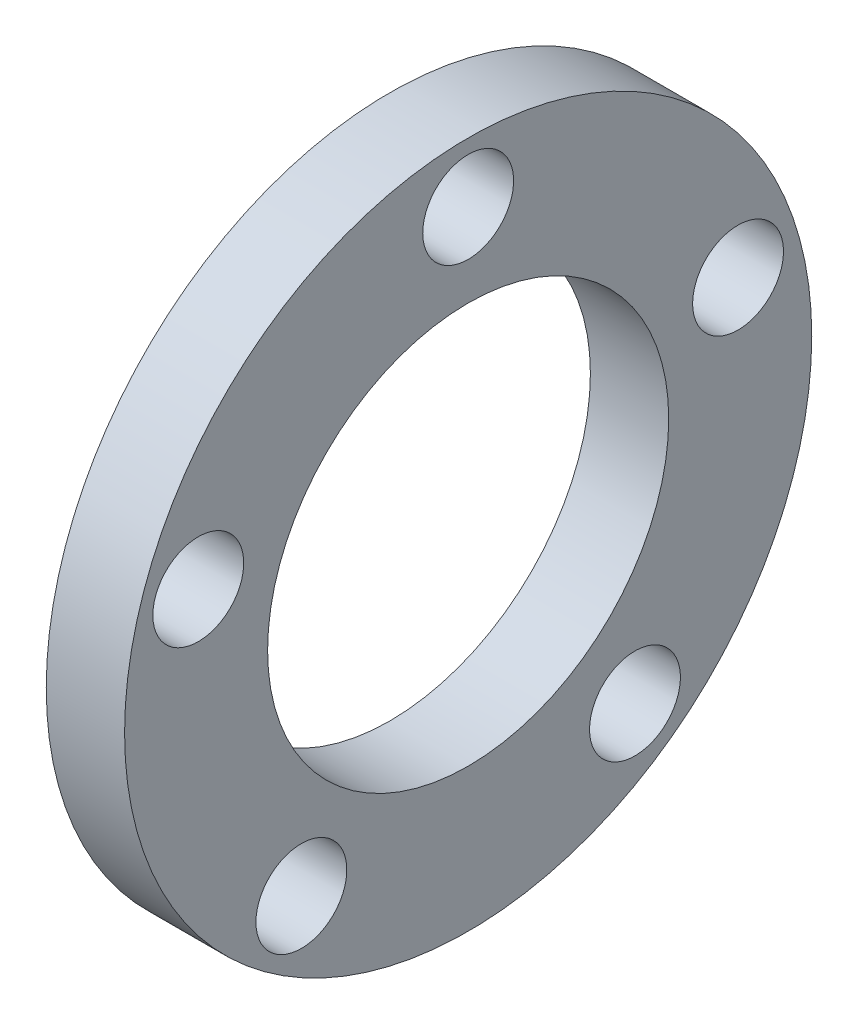
from build123d import *

# Parameters (mm, degrees)
SKETCH1_R           = 13.924461334
SKETCH1_R_2         = 8.128
BOSS_EXTRUDE1_DEPTH = 3.175
SKETCH2_R           = 1.8415
CUT_EXTRUDE1_DEPTH  = 20.946475175


with BuildPart() as part:
    # Sketch1 → Boss-Extrude1 (new body)
    with BuildSketch(Plane(origin=(0, 0, 0), x_dir=(0, 0, -1), z_dir=(1, 0, 0))):
        Circle(SKETCH1_R)
        Circle(SKETCH1_R_2, mode=Mode.SUBTRACT)
    extrude(amount=BOSS_EXTRUDE1_DEPTH)

    # Sketch2 → Cut-Extrude1 (cut, through all)
    with BuildSketch(Plane.ZY):
        with Locations((0, 11.5)):
            Circle(SKETCH2_R)
        with Locations((10.937149937, 3.553695435)):
            Circle(SKETCH2_R)
        with Locations((6.759530401, -9.303695435)):
            Circle(SKETCH2_R)
        with Locations((-6.759530401, -9.303695435)):
            Circle(SKETCH2_R)
        with Locations((-10.937149937, 3.553695435)):
            Circle(SKETCH2_R)
    extrude(amount=-CUT_EXTRUDE1_DEPTH, mode=Mode.SUBTRACT)


solid = part.part
